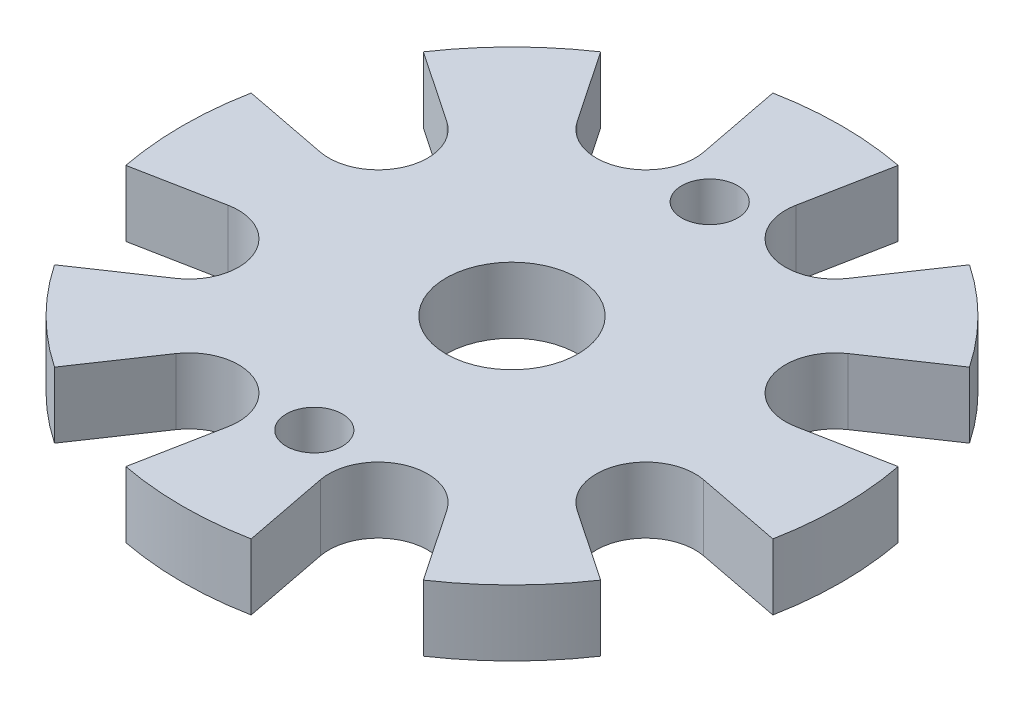
from build123d import *

# Parameters (mm, degrees)
SKETCH1_R           = 20
BOSS_EXTRUDE1_DEPTH = 4
CUT_EXTRUDE1_REACH  = 30.566
SKETCH2_R           = 4
SKETCH2_R_2         = 1.7
CUT_EXTRUDE3_REACH  = 30.566
CIRPATTERN1_COUNT   = 8


with BuildPart() as part:
    # Sketch1 → Boss-Extrude1 (new body)
    with BuildSketch(Plane(origin=(0, 0, 0), x_dir=(1, 0, 0), z_dir=(0, 1, 0))):
        Circle(SKETCH1_R)
    extrude(amount=BOSS_EXTRUDE1_DEPTH)

    # Sketch2 → Cut-Extrude1 (cut, up to next)
    with BuildSketch(Plane(origin=(0, 0, 0), x_dir=(1, 0, 0), z_dir=(0, 1, 0)), mode=Mode.PRIVATE) as cut_extrude1_sk1:
        Circle(SKETCH2_R)
    cut_extrude1_tool1 = extrude(cut_extrude1_sk1.sketch, amount=CUT_EXTRUDE1_REACH, mode=Mode.PRIVATE) & part.part
    # Sketch2 → Cut-Extrude1 (cut, up to next)
    with BuildSketch(Plane(origin=(0, 0, 0), x_dir=(1, 0, 0), z_dir=(0, 1, 0)), mode=Mode.PRIVATE) as cut_extrude1_sk2:
        with Locations((0, 12)):
            Circle(SKETCH2_R_2)
    cut_extrude1_tool2 = extrude(cut_extrude1_sk2.sketch, amount=CUT_EXTRUDE1_REACH, mode=Mode.PRIVATE) & part.part
    # Sketch2 → Cut-Extrude1 (cut, up to next)
    with BuildSketch(Plane(origin=(0, 0, 0), x_dir=(1, 0, 0), z_dir=(0, 1, 0)), mode=Mode.PRIVATE) as cut_extrude1_sk3:
        with Locations((0, -12)):
            Circle(SKETCH2_R_2)
    cut_extrude1_tool3 = extrude(cut_extrude1_sk3.sketch, amount=CUT_EXTRUDE1_REACH, mode=Mode.PRIVATE) & part.part
    add(cut_extrude1_tool1.solids().sort_by_distance((0, 0, 0))[0], mode=Mode.SUBTRACT)
    add(cut_extrude1_tool2.solids().sort_by_distance((0, 0, -12))[0], mode=Mode.SUBTRACT)
    add(cut_extrude1_tool3.solids().sort_by_distance((0, 0, 12))[0], mode=Mode.SUBTRACT)

    # Sketch3 → Cut-Extrude3 (cut, up to next)
    with BuildSketch(Plane(origin=(0, 0, 0), x_dir=(1, 0, 0), z_dir=(0, 1, 0)), mode=Mode.PRIVATE) as cut_extrude3_sk1:
        with BuildLine():
            ThreePointArc((11.194551269, 16.573533778), (7.653668647, 18.47759065), (3.803515008, 19.635001237))
            Line((3.803515008, 19.635001237), (2.7950013, 14.428720239))
            ThreePointArc((2.7950013, 14.428720239), (4.592201188, 11.08655439), (8.226281552, 12.179010297))
            Line((8.226281552, 12.179010297), (11.194551269, 16.573533778))
        make_face()
    cut_extrude3_tool1 = extrude(cut_extrude3_sk1.sketch, amount=CUT_EXTRUDE3_REACH, mode=Mode.PRIVATE) & part.part
    cut_extrude3 = cut_extrude3_tool1.solids().sort_by_distance((6.290655, 0, -15.186984))[0]
    add(cut_extrude3, mode=Mode.SUBTRACT)

    # CirPattern1: Cut-Extrude3 ×8 about axis
    cirpattern1_axis = Axis((0, 4, 0), (0, 1, 0))
    for i in range(1, CIRPATTERN1_COUNT):
        add(cut_extrude3.rotate(cirpattern1_axis, i * 360 / CIRPATTERN1_COUNT), mode=Mode.SUBTRACT)


solid = part.part
